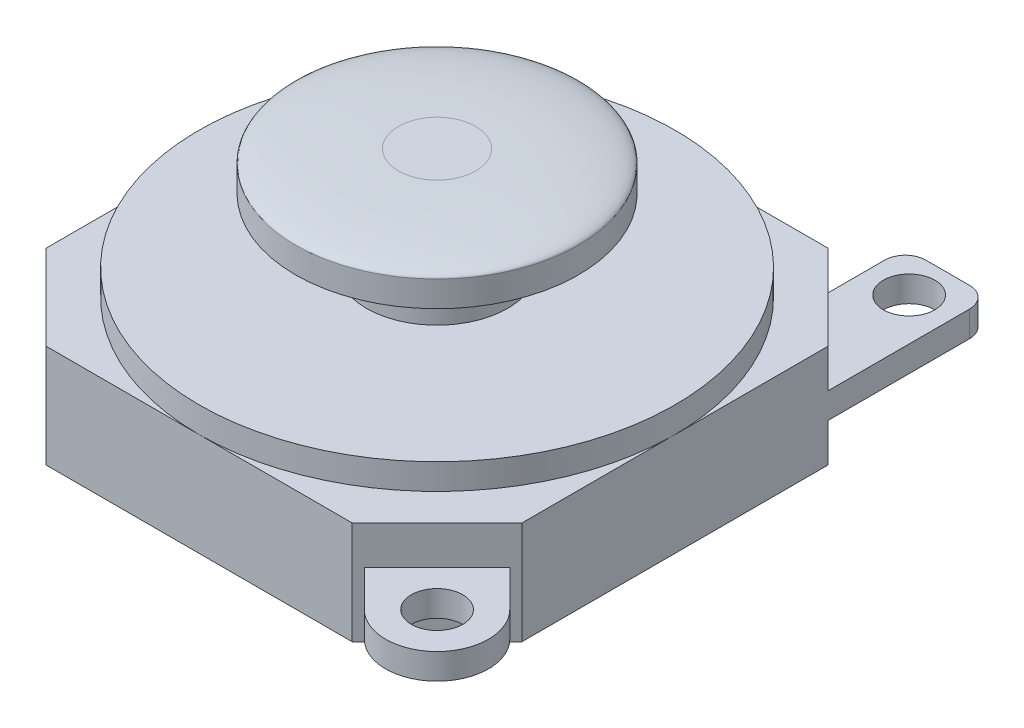
from build123d import *

# Parameters (mm, degrees)
BOSS_EXTRUDE1_DEPTH = 4
SKETCH2_R           = 9.25
BOSS_EXTRUDE2_DEPTH = 1
SKETCH4_R           = 1
BOSS_EXTRUDE3_DEPTH = 1
SKETCH5_R           = 2.75
BOSS_EXTRUDE4_DEPTH = 2.5
SKETCH6_R           = 5.5
BOSS_EXTRUDE5_DEPTH = 1.5
FILLET1_SIZE        = 0.5
FILLET1_SIZE_2      = 4
FILLET2_R           = 0.8
SKETCH7_W           = 1.5
SKETCH7_H           = 3.5
BOSS_EXTRUDE6_DEPTH = 0.1


with BuildPart() as part:
    # Sketch1 → Boss-Extrude1 (new body)
    with BuildSketch(Plane(origin=(0, 0, 0), x_dir=(1, 0, 0), z_dir=(0, 1, 0))):
        Polygon((-5.952795796, 9.25), (5.952795796, 9.25), (9.25, 5.952795796), (9.25, -5.952795796), (5.952795796, -9.25), (-5.952795796, -9.25), (-9.25, -5.952795796), (-9.25, 5.952795796), align=None)
    extrude(amount=BOSS_EXTRUDE1_DEPTH)

    # Sketch4 → Boss-Extrude3 (add)
    # profile 1 of 2: a face of its own
    with BuildSketch(Plane(origin=(0, 1.5, 0), x_dir=(1, 0, 0), z_dir=(0, 1, 0))):
        Polygon((9.25, 5.952795796), (9.25, 12.25), (5.952795796, 12.25), (5.952795796, 9.25), align=None)
        with Locations(Location((7.601397898, 10.75, 0), (0, 0, 270))):
            Circle(SKETCH4_R, mode=Mode.SUBTRACT)
    # profile 2 of 2: a face of its own
    with BuildSketch(Plane(origin=(0, 1.5, 0), x_dir=(1, 0, 0), z_dir=(0, 1, 0))):
        with BuildLine():
            Line((6.187184335, -9.01561146), (7.601397898, -10.429825023))
            ThreePointArc((7.601397898, -10.429825023), (10.429825023, -10.429825023), (10.429825023, -7.601397898))
            Line((10.429825023, -7.601397898), (9.01561146, -6.187184335))
            Line((9.01561146, -6.187184335), (6.187184335, -9.01561146))
        make_face()
        with Locations(Location((9.01561146, -9.01561146, 0), (0, 0, 270))):
            Circle(SKETCH4_R, mode=Mode.SUBTRACT)
    extrude(amount=BOSS_EXTRUDE3_DEPTH)

    # Fillet2
    fillet2_edges = [part.edges().sort_by_distance(p)[0] for p in [
        (9.25, 2, -12.25),
        (5.952795796, 2, -12.25),
    ]]
    fillet(fillet2_edges, radius=FILLET2_R)

    # Sketch7 → Boss-Extrude6 (add)
    with BuildSketch(Plane.XZ):
        with Locations((-3, 7)):
            Rectangle(SKETCH7_W, SKETCH7_H)
        with Locations((-1, 7)):
            Rectangle(SKETCH7_W, SKETCH7_H)
        with Locations((1, 7)):
            Rectangle(SKETCH7_W, SKETCH7_H)
        with Locations((3, 7)):
            Rectangle(SKETCH7_W, SKETCH7_H)
    extrude(amount=BOSS_EXTRUDE6_DEPTH)


with BuildPart() as body_2:
    # Sketch2 → Boss-Extrude2 (new body)
    with BuildSketch(Plane(origin=(0, 4, 0), x_dir=(1, 0, 0), z_dir=(0, 1, 0))):
        with Locations(Location((0, 0, 0), (0, 0, 270))):
            Circle(SKETCH2_R)
    extrude(amount=BOSS_EXTRUDE2_DEPTH)


with BuildPart() as body_3:
    # Sketch5 → Boss-Extrude4 (new body)
    with BuildSketch(Plane(origin=(0, 5, 0), x_dir=(1, 0, 0), z_dir=(0, 1, 0))):
        with Locations(Location((0, 0, 0), (0, 0, 270))):
            Circle(SKETCH5_R)
    extrude(amount=BOSS_EXTRUDE4_DEPTH)


with BuildPart() as body_4:
    # Sketch6 → Boss-Extrude5 (new body)
    with BuildSketch(Plane(origin=(0, 7.5, 0), x_dir=(1, 0, 0), z_dir=(0, 1, 0))):
        with Locations(Location((0, 0, 0), (0, 0, 270))):
            Circle(SKETCH6_R)
    extrude(amount=BOSS_EXTRUDE5_DEPTH)

    # Fillet1
    # an asymmetric fillet: 4, 0.5 mm, written as the material it takes off along each edge
    with BuildSketch(Plane(origin=(0, 9, 0), x_dir=(0, 0, 1), z_dir=(-1, 0, 0))) as fillet1_piece_1:
        with BuildLine():
            Bezier((5.5, -FILLET1_SIZE), (5.5, 0), (5.5 - FILLET1_SIZE_2, 0), weights=[1, 0.707106781, 1])
            Line((5.5 - FILLET1_SIZE_2, 0), (5.5, 0))
            Line((5.5, 0), (5.5, -FILLET1_SIZE))
        make_face()
    revolve(axis=Axis((0, 9, 0), (0, 1, 0)), mode=Mode.SUBTRACT)


solid = Compound([part.part, body_2.part, body_3.part, body_4.part])
